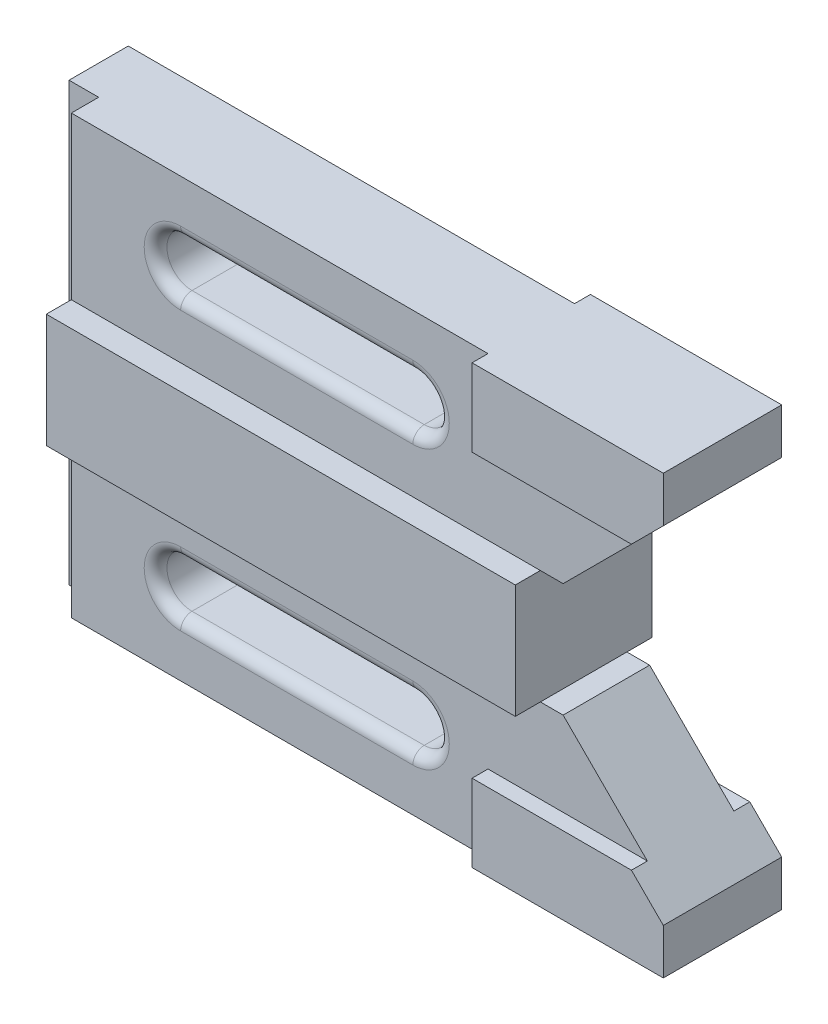
from build123d import *

# Parameters (mm, degrees)
SKETCH2_W               = 109.5
SKETCH2_H               = 12.5
BOSS_EXTRUDE1_DEPTH     = 15
BOSS_EXTRUDE2_DEPTH     = 13
BOSS_EXTRUDE3_DEPTH     = 9.5
CUT_EXTRUDE1_DEPTH      = 149.758193052
CUT_EXTRUDE1_DEPTH_BACK = 149.758193052
SKETCH3_W               = 6.5
SKETCH3_H               = 11.5
FILLET2_R               = 2.5


with BuildPart() as part:
    # Sketch2 → Boss-Extrude1 (new, symmetric)
    with BuildSketch(Plane.XY):
        with Locations((54.75, 6.25)):
            Rectangle(SKETCH2_W, SKETCH2_H)
    extrude(amount=BOSS_EXTRUDE1_DEPTH, both=True)



with BuildPart() as body_2:
    # Sketch2<3> → Boss-Extrude2 (new, symmetric)
    with BuildSketch(Plane.XY):
        Polygon((140, 48), (98, 48), (98, 31), (133, 31), (140, 38), align=None)
    extrude(amount=BOSS_EXTRUDE2_DEPTH, both=True)


with BuildPart() as part_1:
    add(part.part)

    add(body_2.part)  # Boss-Extrude3 merges body 2
    # Sketch2<4> → Boss-Extrude3 (add, symmetric)
    with BuildSketch(Plane.XY):
        Polygon((0, 30.5), (0, 12.5), (109.5, 12.5), (114.5, 12.5), (133, 31), (98, 31), (98, 48), (0, 48), align=None)
        with BuildLine():
            ThreePointArc((30.5, 25), (26.610912703, 26.610912703), (25, 30.5))
            ThreePointArc((25, 30.5), (26.610912703, 34.389087297), (30.5, 36))
            Line((30.5, 36), (81.5, 36))
            ThreePointArc((81.5, 36), (87, 30.5), (81.5, 25))
            Line((81.5, 25), (30.5, 25))
        make_face(mode=Mode.SUBTRACT)
    extrude(amount=BOSS_EXTRUDE3_DEPTH, both=True)

    # Sketch3 → Cut-Extrude1 (cut, two sides: drawn at the far end of the back side and taken through both)
    with BuildSketch(Plane(origin=(0, 48, 0), x_dir=(1, 0, 0), z_dir=(0, 1, 0)).offset(-CUT_EXTRUDE1_DEPTH_BACK)):
        with Locations((3.25, -9.25)):
            Rectangle(SKETCH3_W, SKETCH3_H)
    extrude(amount=CUT_EXTRUDE1_DEPTH + CUT_EXTRUDE1_DEPTH_BACK, mode=Mode.SUBTRACT)

    # Mirror1: part across plane


with BuildPart() as part_2:
    add(part_1.part)
    add(part_1.part.mirror(Plane(origin=(0, 0, 15), x_dir=(0, 0, 1), z_dir=(0, 1, 0))))

    # Fillet2
    fillet2_edges = [part_2.edges().sort_by_distance(p)[0] for p in [
        (56, -25, 9.5),
        (56, 36, 9.5),
        (87, 30.5, -9.5),
        (56, 36, -9.5),
        (56, 25, -9.5),
        (25, 30.5, -9.5),
        (87, 30.5, 9.5),
        (25, 30.5, 9.5),
        (56, 25, 9.5),
        (56, -25, -9.5),
        (87, -30.5, -9.5),
        (56, -36, -9.5),
        (25, -30.5, -9.5),
        (87, -30.5, 9.5),
        (25, -30.5, 9.5),
        (56, -36, 9.5),
    ]]
    fillet(fillet2_edges, radius=FILLET2_R)


solid = part_2.part
